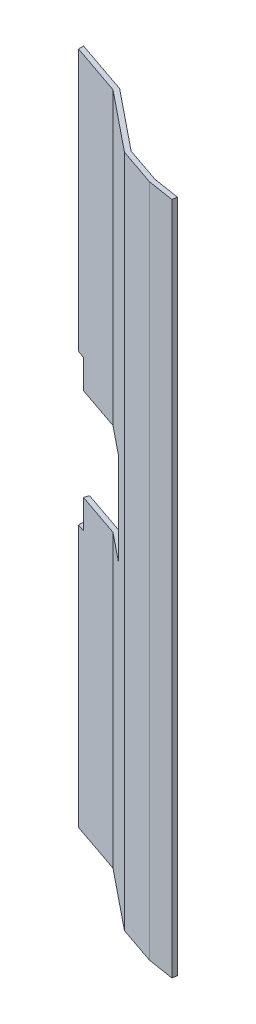
from build123d import *

# Parameters (mm, degrees)
BOSS_EXTRUDE2_DEPTH     = 222.25
CUT_EXTRUDE2_DEPTH      = 227.41634643
CUT_EXTRUDE2_DEPTH_BACK = 227.41634643


with BuildPart() as part:
    # Sketch3 → Boss-Extrude2 (new body)
    with BuildSketch(Plane(origin=(0, 0, 0), x_dir=(1, 0, 0), z_dir=(0, 1, 0))):
        Polygon((-37.062566366, 21.904788086), (-19.755538483, 15.964920897), (0, 0), (12.541749156, -4.304397313), (21.323689681, -5.686287551), (21.57426256, -4.093891817), (12.792322036, -2.712001578), (0.780092903, 1.410661549), (-18.975445581, 17.375582446), (-37.062566366, 23.583181811), align=None)
    extrude(amount=BOSS_EXTRUDE2_DEPTH)

    # Sketch4 → Cut-Extrude2 (cut, two sides: drawn at the far end of the back side and taken through both)
    with BuildSketch(Plane(origin=(3.335400558, 0, -9.718377301), x_dir=(-0.9458448136074452, 0, -0.3246191438777098), z_dir=(0.3246191438777098, 0, -0.9458448136074453)).offset(-CUT_EXTRUDE2_DEPTH_BACK)):
        Polygon((42.710988466, 135.89), (39.535988466, 135.89), (39.535988466, 126.365), (12.230988466, 126.365), (12.230988466, 95.885), (39.535988466, 95.885), (39.535988466, 86.36), (42.710988466, 86.36), align=None)
    extrude(amount=CUT_EXTRUDE2_DEPTH + CUT_EXTRUDE2_DEPTH_BACK, mode=Mode.SUBTRACT)


solid = part.part
